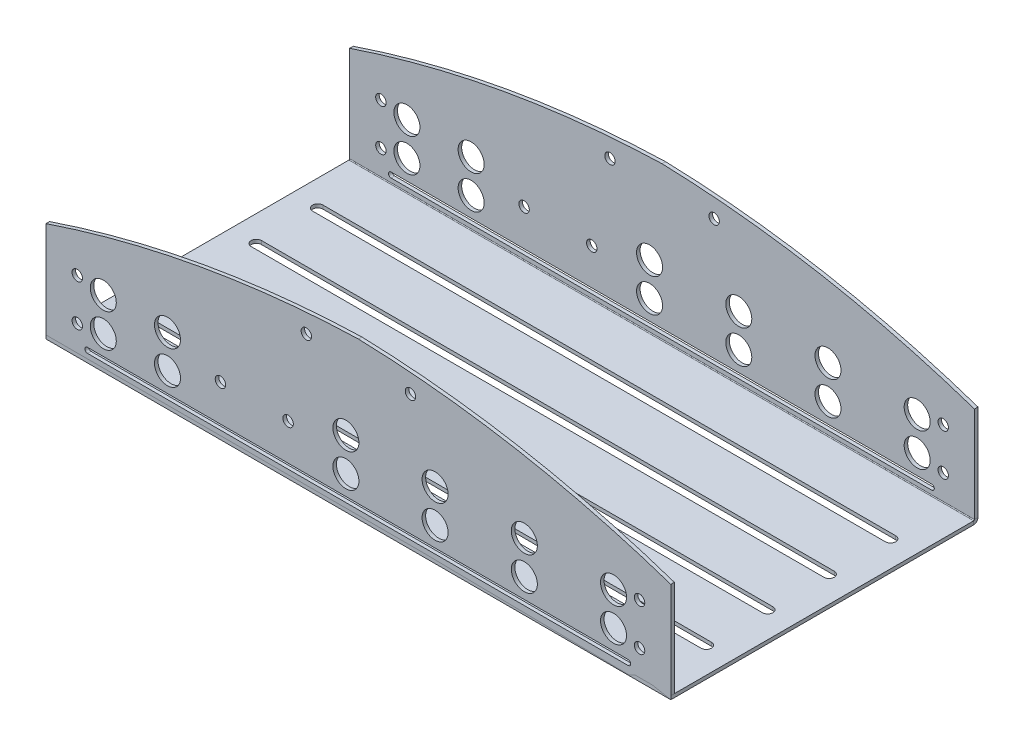
from build123d import *

# Parameters (mm, degrees)
SKETCH1_R                    = 12.5
SKETCH1_R_2                  = 5
BASE_FLANGE1_DEPTH           = 3.4
EDGE_FLANGE1_STRIP_W         = 15.0732
EDGE_FLANGE1_STRIP_H         = 3.4
EDGE_FLANGE1_STRIP_CUT_DEPTH = 600
EDGE_FLANGE1_DEPTH           = 600
SKETCH9_R                    = 12.5
SKETCH9_R_2                  = 5
BASE_FLANGE3_DEPTH           = 3.4
CUT_EXTRUDE1_DEPTH           = 3.4
CUT_EXTRUDE2_DEPTH           = 676.126548333
LPATTERN1_COUNT              = 4
LPATTERN1_PITCH              = 59


# Sheet-metal steps are written as plain solids
with BuildPart() as part:
    # Sketch1 → Base-Flange1 (new body)
    with BuildSketch(Plane.XY):
        with BuildLine():
            Line((0, -56.347150259), (0, 39.652849741))
            ThreePointArc((0, 39.652849741), (-147.993631147, 77.79934337), (-300, 93.652849741))
            ThreePointArc((-300, 93.652849741), (-452.006368853, 77.79934337), (-600, 39.652849741))
            Line((-600, 39.652849741), (-600, -56.347150259))
            Line((-600, -56.347150259), (0, -56.347150259))
        make_face()
        with Locations((-55, 7.652849741)):
            Circle(SKETCH1_R, mode=Mode.SUBTRACT)
        with Locations((-55, -24.347150259)):
            Circle(SKETCH1_R, mode=Mode.SUBTRACT)
        with Locations(Location((-545, 7.652849741, 0), (0, 0, 180))):
            Circle(SKETCH1_R, mode=Mode.SUBTRACT)
        with Locations(Location((-545, -24.347150259, 0), (0, 0, 180))):
            Circle(SKETCH1_R, mode=Mode.SUBTRACT)
        with Locations((-140.666666667, 7.652849741)):
            Circle(SKETCH1_R, mode=Mode.SUBTRACT)
        with Locations((-140.666666667, -24.347150259)):
            Circle(SKETCH1_R, mode=Mode.SUBTRACT)
        with Locations((-226.333333333, 7.652849741)):
            Circle(SKETCH1_R, mode=Mode.SUBTRACT)
        with Locations((-226.333333333, -24.347150259)):
            Circle(SKETCH1_R, mode=Mode.SUBTRACT)
        with Locations((-312, 7.652849741)):
            Circle(SKETCH1_R, mode=Mode.SUBTRACT)
        with Locations((-312, -24.347150259)):
            Circle(SKETCH1_R, mode=Mode.SUBTRACT)
        with Locations((-483.333333333, 7.652849741)):
            Circle(SKETCH1_R, mode=Mode.SUBTRACT)
        with Locations((-483.333333333, -24.347150259)):
            Circle(SKETCH1_R, mode=Mode.SUBTRACT)
        with Locations((-350, 72.948827057)):
            Circle(SKETCH1_R_2, mode=Mode.SUBTRACT)
        with Locations(Location((-250, 72.948827057, 0), (0, 0, 180))):
            Circle(SKETCH1_R_2, mode=Mode.SUBTRACT)
        with Locations(Location((-30, 11.652849741, 0), (0, 0, 180))):
            Circle(SKETCH1_R_2, mode=Mode.SUBTRACT)
        with Locations(Location((-30, -28.347150259, 0), (0, 0, 180))):
            Circle(SKETCH1_R_2, mode=Mode.SUBTRACT)
        with Locations((-570, -28.347150259)):
            Circle(SKETCH1_R_2, mode=Mode.SUBTRACT)
        with Locations((-570, 11.652849741)):
            Circle(SKETCH1_R_2, mode=Mode.SUBTRACT)
        with Locations((-367.5, -8.347150259)):
            Circle(SKETCH1_R_2, mode=Mode.SUBTRACT)
        with Locations(Location((-432.5, -8.347150259, 0), (0, 0, 180))):
            Circle(SKETCH1_R_2, mode=Mode.SUBTRACT)
    extrude(amount=-BASE_FLANGE1_DEPTH)

    # Edge-Flange1 strip (across the edge) → Edge-Flange1 strip cut (cut)
    with BuildSketch(Plane(origin=(-600, -56.347150259, 0), x_dir=(0, 1, 0), z_dir=(1, 0, 0))):
        with Locations((-3.4, -1.7)):
            Rectangle(EDGE_FLANGE1_STRIP_W, EDGE_FLANGE1_STRIP_H)
    extrude(amount=EDGE_FLANGE1_STRIP_CUT_DEPTH, mode=Mode.SUBTRACT)

    # Edge-Flange1 section (across the edge) → Edge-Flange1 (add)
    with BuildSketch(Plane(origin=(-600, -56.347150259, 0), x_dir=(0, 1, 0), z_dir=(1, 0, 0))):
        with BuildLine():
            Line((0, 0.7366), (0, 291.6))
            Line((0, 291.6), (3.4, 291.6))
            Line((3.4, 291.6), (3.4, 0.7366))
            ThreePointArc((3.4, 0.7366), (3.615745145, 0.215745145), (4.1366, 0))
            Line((4.1366, 0), (4.1366, -3.4))
            ThreePointArc((4.1366, -3.4), (1.211582089, -2.188417911), (0, 0.7366))
        make_face()
    extrude(amount=EDGE_FLANGE1_DEPTH)

    # Sketch10 → Cut-Extrude1 (cut)
    with BuildSketch(Plane.XZ.offset(56.347150259)):
        with BuildLine():
            Line((-575, 237.6), (-25, 237.6))
            ThreePointArc((-25, 237.6), (-20, 232.6), (-25, 227.6))
            Line((-25, 227.6), (-575, 227.6))
            ThreePointArc((-575, 227.6), (-580, 232.6), (-575, 237.6))
        make_face()
    cut_extrude1 = extrude(amount=-CUT_EXTRUDE1_DEPTH, mode=Mode.SUBTRACT)


with BuildPart() as body_2:
    # Sketch9 → Base-Flange3 (new body)
    with BuildSketch(Plane.XY.offset(291.6)):
        with BuildLine():
            Line((0, -56.347150259), (0, 39.652849741))
            ThreePointArc((0, 39.652849741), (-147.993631147, 77.79934337), (-300, 93.652849741))
            ThreePointArc((-300, 93.652849741), (-452.006368853, 77.79934337), (-600, 39.652849741))
            Line((-600, 39.652849741), (-600, -56.347150259))
            Line((-600, -56.347150259), (0, -56.347150259))
        make_face()
        with Locations((-545, 7.652849741)):
            Circle(SKETCH9_R, mode=Mode.SUBTRACT)
        with Locations((-55, -24.347150259)):
            Circle(SKETCH9_R, mode=Mode.SUBTRACT)
        with Locations((-55, 7.652849741)):
            Circle(SKETCH9_R, mode=Mode.SUBTRACT)
        with Locations((-312, -24.347150259)):
            Circle(SKETCH9_R, mode=Mode.SUBTRACT)
        with Locations((-312, 7.652849741)):
            Circle(SKETCH9_R, mode=Mode.SUBTRACT)
        with Locations((-226.333333333, -24.347150259)):
            Circle(SKETCH9_R, mode=Mode.SUBTRACT)
        with Locations((-226.333333333, 7.652849741)):
            Circle(SKETCH9_R, mode=Mode.SUBTRACT)
        with Locations((-140.666666667, -24.347150259)):
            Circle(SKETCH9_R, mode=Mode.SUBTRACT)
        with Locations((-140.666666667, 7.652849741)):
            Circle(SKETCH9_R, mode=Mode.SUBTRACT)
        with Locations((-545, -24.347150259)):
            Circle(SKETCH9_R, mode=Mode.SUBTRACT)
        with Locations((-483.333333333, -24.347150259)):
            Circle(SKETCH9_R, mode=Mode.SUBTRACT)
        with Locations((-483.333333333, 7.652849741)):
            Circle(SKETCH9_R, mode=Mode.SUBTRACT)
        with Locations((-350, 72.948827057)):
            Circle(SKETCH9_R_2, mode=Mode.SUBTRACT)
        with Locations((-250, 72.948827057)):
            Circle(SKETCH9_R_2, mode=Mode.SUBTRACT)
        with Locations((-30, 11.652849741)):
            Circle(SKETCH9_R_2, mode=Mode.SUBTRACT)
        with Locations((-30, -28.347150259)):
            Circle(SKETCH9_R_2, mode=Mode.SUBTRACT)
        with Locations((-570, -28.347150259)):
            Circle(SKETCH9_R_2, mode=Mode.SUBTRACT)
        with Locations((-570, 11.652849741)):
            Circle(SKETCH9_R_2, mode=Mode.SUBTRACT)
        with Locations((-432.5, -8.347150259)):
            Circle(SKETCH9_R_2, mode=Mode.SUBTRACT)
        with Locations((-367.5, -8.347150259)):
            Circle(SKETCH9_R_2, mode=Mode.SUBTRACT)
    extrude(amount=-BASE_FLANGE3_DEPTH)


with BuildPart() as cut_extrude2_tool:
    # Sketch11 → Cut-Extrude2 (new, through all)
    with BuildSketch(Plane.XY.offset(291.6)):
        with BuildLine():
            Line((-560.23321105, -43.347150259), (-41.078117015, -43.347150259))
            ThreePointArc((-41.078117015, -43.347150259), (-38.578117015, -45.847150259), (-41.078117015, -48.347150259))
            Line((-41.078117015, -48.347150259), (-560.23321105, -48.347150259))
            ThreePointArc((-560.23321105, -48.347150259), (-562.73321105, -45.847150259), (-560.23321105, -43.347150259))
        make_face()
    extrude(amount=-CUT_EXTRUDE2_DEPTH)


with BuildPart() as part_1:
    add(part.part)

    # Cut-Extrude2: cut by cut_extrude2_tool
    add(cut_extrude2_tool.part, mode=Mode.SUBTRACT)

    # LPattern1: Cut-Extrude1 ×4
    with Locations(*[(0, 0, -i * LPATTERN1_PITCH) for i in range(1, LPATTERN1_COUNT)]):
        add(cut_extrude1, mode=Mode.SUBTRACT)


with BuildPart() as body_2_1:
    add(body_2.part)

    # Cut-Extrude2: cut by cut_extrude2_tool
    add(cut_extrude2_tool.part, mode=Mode.SUBTRACT)


solid = Compound([part_1.part, body_2_1.part])
